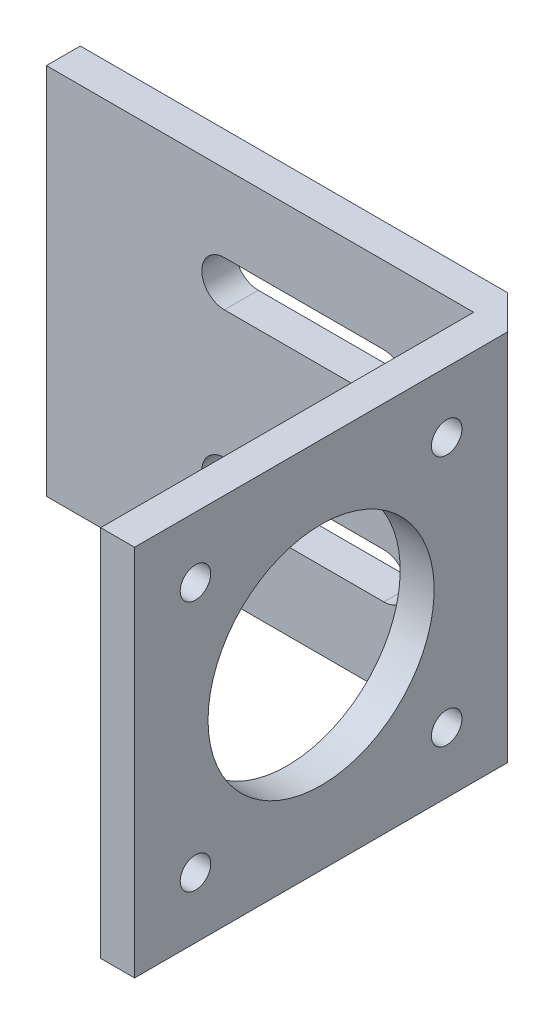
from build123d import *

# Parameters (mm, degrees)
SKETCH1_W           = 41.91
SKETCH1_H           = 41.91
SKETCH1_R           = 12.7
SKETCH1_R_2         = 1.714924581
BOSS_EXTRUDE1_DEPTH = 3.81
SKETCH2_W           = 48.006
SKETCH2_H           = 41.91
BOSS_EXTRUDE2_DEPTH = 3.81
LOFT1_START         = -20.955
LOFT1_DEPTH         = 41.91


# Read off the part's stored shape, not the designer's step: Loft1
with BuildPart() as part:
    # Sketch1 → Boss-Extrude1 (new body)
    with BuildSketch(Plane(origin=(0, 0, 0), x_dir=(0, 0, -1), z_dir=(1, 0, 0))):
        Rectangle(SKETCH1_W, SKETCH1_H)
        with Locations(Location((0, 0, 0), (0, 0, 180))):
            Circle(SKETCH1_R, mode=Mode.SUBTRACT)
        with Locations(Location((14.112032399, 14.112032399, 0), (0, 0, 180))):
            Circle(SKETCH1_R_2, mode=Mode.SUBTRACT)
        with Locations(Location((-14.112032399, -14.112032399, 0), (0, 0, 180))):
            Circle(SKETCH1_R_2, mode=Mode.SUBTRACT)
        with Locations(Location((-14.112032399, 14.112032399, 0), (0, 0, 180))):
            Circle(SKETCH1_R_2, mode=Mode.SUBTRACT)
        with Locations(Location((14.112032399, -14.112032399, 0), (0, 0, 180))):
            Circle(SKETCH1_R_2, mode=Mode.SUBTRACT)
    extrude(amount=BOSS_EXTRUDE1_DEPTH)



with BuildPart() as body_2:
    # Sketch2 → Boss-Extrude2 (new body)
    with BuildSketch(Plane(origin=(0, 0, -20.955), x_dir=(-1, 0, 0), z_dir=(0, 0, -1))):
        with Locations((24.003, 0)):
            Rectangle(SKETCH2_W, SKETCH2_H)
        with BuildLine():
            Line((10.094228129, 7.189050974), (28.005771871, 7.189050974))
            ThreePointArc((28.005771871, 7.189050974), (30.545771871, 9.729050974), (28.005771871, 12.269050974))
            Line((28.005771871, 12.269050974), (10.094228129, 12.269050974))
            ThreePointArc((10.094228129, 12.269050974), (7.554228129, 9.729050974), (10.094228129, 7.189050974))
        make_face(mode=Mode.SUBTRACT)
        with BuildLine():
            Line((10.094228129, -7.189050974), (28.005771871, -7.189050974))
            ThreePointArc((28.005771871, -7.189050974), (30.545771871, -9.729050974), (28.005771871, -12.269050974))
            Line((28.005771871, -12.269050974), (10.094228129, -12.269050974))
            ThreePointArc((10.094228129, -12.269050974), (7.554228129, -9.729050974), (10.094228129, -7.189050974))
        make_face(mode=Mode.SUBTRACT)
    extrude(amount=BOSS_EXTRUDE2_DEPTH)


with BuildPart() as part_1:
    add(part.part)

    add(body_2.part)  # Loft1 merges body 2
    # Loft1 outline → Loft1 (add)
    with BuildSketch(Plane(origin=(0, 0, 0), x_dir=(1, 0, 0), z_dir=(0, 1, 0)).offset(LOFT1_START)):
        Polygon((3.81, 20.955), (0, 24.765), (0, 20.955), align=None)
    extrude(amount=LOFT1_DEPTH)


solid = part_1.part
